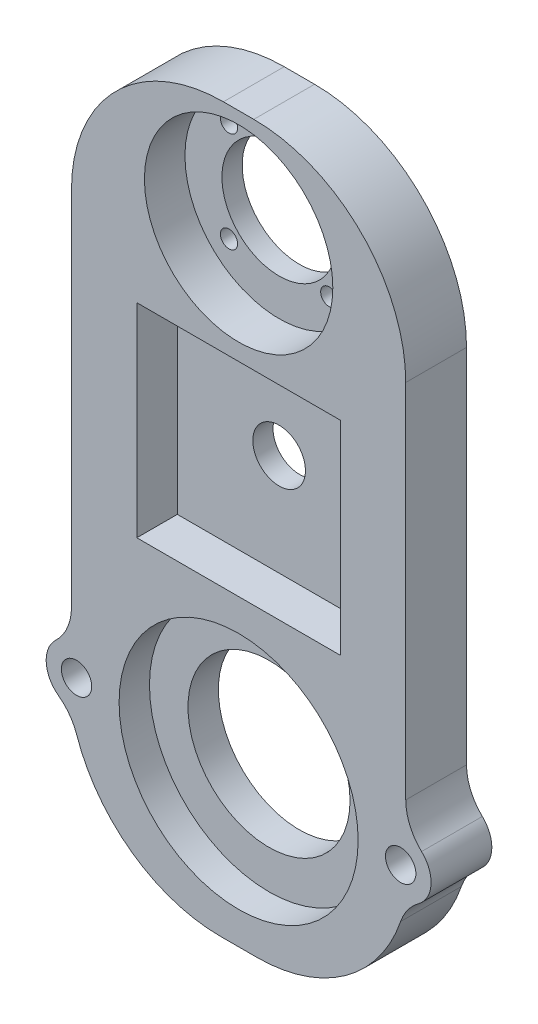
from build123d import *

# Parameters (mm, degrees)
SKETCH1_W           = 66
SKETCH1_H           = 143
SKETCH1_R           = 16
SKETCH1_R_2         = 5.2
SKETCH1_R_3         = 11.3
SKETCH1_R_4         = 1.7
BOSS_EXTRUDE1_DEPTH = 12
SKETCH3_R           = 18.6
SKETCH3_W           = 40.2
SKETCH3_H           = 40.2
CUT_EXTRUDE1_DEPTH  = 8
SKETCH4_R           = 23.6
CUT_EXTRUDE2_DEPTH  = 6
SKETCH5_R           = 6
BOSS_EXTRUDE2_DEPTH = 12
SKETCH5_3_R         = 3
CUT_EXTRUDE3_DEPTH  = 120.82069938
FILLET1_R           = 30
VERRUNDUNG1_R       = 10


with BuildPart() as part:
    # Sketch1 → Boss-Extrude1 (new body)
    with BuildSketch(Plane.XY):
        with Locations((0, 41.5)):
            Rectangle(SKETCH1_W, SKETCH1_H)
        Circle(SKETCH1_R, mode=Mode.SUBTRACT)
        with Locations((0, 50)):
            Circle(SKETCH1_R_2, mode=Mode.SUBTRACT)
        with Locations((0, 92)):
            Circle(SKETCH1_R_3, mode=Mode.SUBTRACT)
        with Locations((-9.9, 101.9)):
            Circle(SKETCH1_R_4, mode=Mode.SUBTRACT)
        with Locations((9.9, 101.9)):
            Circle(SKETCH1_R_4, mode=Mode.SUBTRACT)
        with Locations((9.9, 82.1)):
            Circle(SKETCH1_R_4, mode=Mode.SUBTRACT)
        with Locations((-9.9, 82.1)):
            Circle(SKETCH1_R_4, mode=Mode.SUBTRACT)
    extrude(amount=BOSS_EXTRUDE1_DEPTH)

    # Sketch3 → Cut-Extrude1 (cut)
    with BuildSketch(Plane.XY.offset(12)):
        with Locations((0, 92)):
            Circle(SKETCH3_R)
        with Locations((0, 50)):
            Rectangle(SKETCH3_W, SKETCH3_H)
    extrude(amount=-CUT_EXTRUDE1_DEPTH, mode=Mode.SUBTRACT)

    # Sketch4 → Cut-Extrude2 (cut)
    with BuildSketch(Plane.XY.offset(12)):
        Circle(SKETCH4_R)
    extrude(amount=-CUT_EXTRUDE2_DEPTH, mode=Mode.SUBTRACT)

    # Sketch5 → Boss-Extrude2 (add)
    with BuildSketch(Plane.XY):
        with Locations((-32, 0)):
            Circle(SKETCH5_R)
        with Locations((32, 0)):
            Circle(SKETCH5_R)
    extrude(amount=BOSS_EXTRUDE2_DEPTH)

    # Sketch5<3> → Cut-Extrude3 (cut, through all)
    with BuildSketch(Plane.XY):
        with Locations((32, 0)):
            Circle(SKETCH5_3_R)
        with Locations((-32, 0)):
            Circle(SKETCH5_3_R)
    extrude(amount=CUT_EXTRUDE3_DEPTH, mode=Mode.SUBTRACT)

    # Fillet1
    # the kernel refuses this fillet: 30 mm, written as the material it takes off along each edge
    with BuildSketch(Plane(origin=(-33, 113, -75), x_dir=(1, 0, 0), z_dir=(0, 0, 1))) as fillet1_piece_1:
        with BuildLine():
            CenterArc((FILLET1_R, -FILLET1_R), FILLET1_R, 90, 90)
            Line((0, -FILLET1_R), (-FILLET1_R * 0.02, -FILLET1_R))
            Line((-FILLET1_R * 0.02, -FILLET1_R), (-FILLET1_R * 0.02, FILLET1_R * 0.02))
            Line((-FILLET1_R * 0.02, FILLET1_R * 0.02), (FILLET1_R, FILLET1_R * 0.02))
            Line((FILLET1_R, FILLET1_R * 0.02), (FILLET1_R, 0))
        make_face()
    extrude(amount=162, mode=Mode.SUBTRACT)
    with BuildSketch(Plane(origin=(33, 113, -75), x_dir=(-1, 0, 0), z_dir=(0, 0, 1))) as fillet1_piece_2:
        with BuildLine():
            CenterArc((FILLET1_R, FILLET1_R), FILLET1_R, 180, 90)
            Line((0, FILLET1_R), (-FILLET1_R * 0.02, FILLET1_R))
            Line((-FILLET1_R * 0.02, FILLET1_R), (-FILLET1_R * 0.02, -FILLET1_R * 0.02))
            Line((-FILLET1_R * 0.02, -FILLET1_R * 0.02), (FILLET1_R, -FILLET1_R * 0.02))
            Line((FILLET1_R, -FILLET1_R * 0.02), (FILLET1_R, 0))
        make_face()
    extrude(amount=162, mode=Mode.SUBTRACT)
    with BuildSketch(Plane(origin=(33, -30, -73.527205849), x_dir=(-1, 0, 0), z_dir=(0, 0, 1))) as fillet1_piece_3:
        with BuildLine():
            CenterArc((29.41088234, -30), FILLET1_R, 90, 78.626574363)
            Line((0, -24.083920217), (-0.588217647, -23.965598621))
            ThreePointArc((-0.588217647, -23.965598621), (-0.6, -12.041960108), (-0.6, 0))
            Line((-0.6, 0), (0, 0.6))
            Line((0, 0.6), (29.41088234, 0.6))
            Line((29.41088234, 0.6), (29.41088234, 0))
        make_face()
    extrude(amount=159.054411699, mode=Mode.SUBTRACT)
    with BuildSketch(Plane(origin=(-33, -30, -73.527205849), x_dir=(0, 1, 0), z_dir=(0, 0, 1))) as fillet1_piece_4:
        with BuildLine():
            CenterArc((30, -29.41088234), FILLET1_R, 101.373425637, 78.626574363)
            Line((0, -29.41088234), (-0.6, -29.41088234))
            Line((-0.6, -29.41088234), (-0.6, 0))
            Line((-0.6, 0), (0, 0.6))
            ThreePointArc((0, 0.6), (12.041960108, 0.6), (23.965598621, 0.588217647))
            Line((23.965598621, 0.588217647), (24.083920217, 0))
        make_face()
    extrude(amount=159.054411699, mode=Mode.SUBTRACT)

    # Verrundung1
    verrundung1_edges = [part.edges().sort_by_distance(p)[0] for p in [
        (-33, 5.916079783, 6),
        (-33, -5.916079783, 6),
        (33, -5.916079783, 6),
        (33, 5.916079783, 6),
    ]]
    fillet(verrundung1_edges, radius=VERRUNDUNG1_R)


solid = part.part
